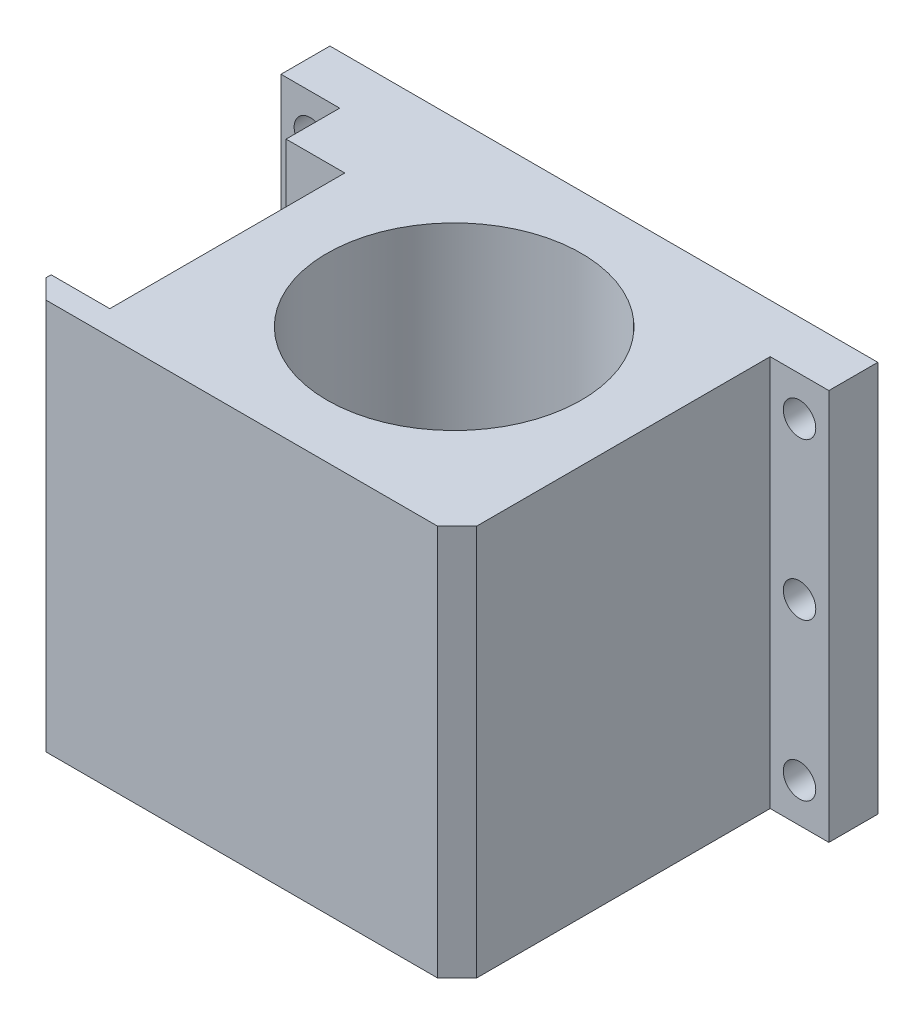
from build123d import *

# Parameters (mm, degrees)
SKETCH_1_W           = 140
SKETCH_1_H           = 100
EXTRUDE_1_DEPTH      = 92.5
SKETCH_2_R           = 32.5
CUT_EXTRUDE_1_DEPTH  = 196.336248556
SKETCH_3_OUTSIDE_W   = 181.068
SKETCH_3_OUTSIDE_H   = 141.068
SKETCH_3_OUTSIDE_W_2 = 110
SKETCH_3_OUTSIDE_H_2 = 100
CUT_EXTRUDE_2_DEPTH  = 80
SKETCH_5_W           = 60.05
SKETCH_5_H           = 100
CUT_EXTRUDE_3_DEPTH  = 15
CHAMFER_2_SIZE       = 5
SKETCH_6_R           = 2.6
CUT_EXTRUDE_4_DEPTH  = 20
SKETCH_9_R           = 4.15
CUT_EXTRUDE_5_DEPTH  = 190.73665961


with BuildPart() as part:
    # 草图1 → 凸台-拉伸1 (new body)
    with BuildSketch(Plane.XY):
        with Locations((70, -50)):
            Rectangle(SKETCH_1_W, SKETCH_1_H)
    extrude(amount=EXTRUDE_1_DEPTH)

    # 草图2 → 切除-拉伸1 (cut, through all)
    with BuildSketch(Plane(origin=(0, 0, 0), x_dir=(1, 0, 0), z_dir=(0, 1, 0))):
        with Locations((78, -46.25)):
            Circle(SKETCH_2_R)
    extrude(amount=-CUT_EXTRUDE_1_DEPTH, mode=Mode.SUBTRACT)

    # 草图3 outside → 切除-拉伸2 (cut)
    with BuildSketch(Plane.XY.offset(92.5)):
        with Locations((70, -50)):
            Rectangle(SKETCH_3_OUTSIDE_W, SKETCH_3_OUTSIDE_H)
        with Locations((70, -50)):
            Rectangle(SKETCH_3_OUTSIDE_W_2, SKETCH_3_OUTSIDE_H_2, mode=Mode.SUBTRACT)
    extrude(amount=-CUT_EXTRUDE_2_DEPTH, mode=Mode.SUBTRACT)

    # 草图5 → 切除-拉伸3 (cut)
    with BuildSketch(Plane.ZY.offset(-15)):
        with Locations((56.225, -50)):
            Rectangle(SKETCH_5_W, SKETCH_5_H)
    extrude(amount=-CUT_EXTRUDE_3_DEPTH, mode=Mode.SUBTRACT)

    # 倒角2
    chamfer_2_edges = [part.edges().sort_by_distance(p)[0] for p in [
        (125, -50, 92.5),
        (15, -50, 92.5),
    ]]
    chamfer(chamfer_2_edges, length=CHAMFER_2_SIZE)

    # 草图6 → 切除-拉伸4 (cut)
    with BuildSketch(Plane.XZ.offset(100)):
        with Locations((78, 85.75)):
            Circle(SKETCH_6_R)
        with Locations((112.208003449, 66)):
            Circle(SKETCH_6_R)
        with Locations((112.208003449, 26.5)):
            Circle(SKETCH_6_R)
        with Locations((78, 6.75)):
            Circle(SKETCH_6_R)
        with Locations((43.791996551, 26.5)):
            Circle(SKETCH_6_R)
        with Locations((43.791996551, 66)):
            Circle(SKETCH_6_R)
    extrude(amount=-CUT_EXTRUDE_4_DEPTH, mode=Mode.SUBTRACT)

    # 草图9 → 切除-拉伸5 (cut, through all)
    with BuildSketch(Plane.XY.offset(12.5)):
        with Locations((7.5, -10)):
            Circle(SKETCH_9_R)
        with Locations((132.5, -10)):
            Circle(SKETCH_9_R)
        with Locations((132.5, -50)):
            Circle(SKETCH_9_R)
        with Locations((132.5, -90)):
            Circle(SKETCH_9_R)
        with Locations((7.5, -50)):
            Circle(SKETCH_9_R)
        with Locations((7.5, -90)):
            Circle(SKETCH_9_R)
    extrude(amount=-CUT_EXTRUDE_5_DEPTH, mode=Mode.SUBTRACT)


solid = part.part
